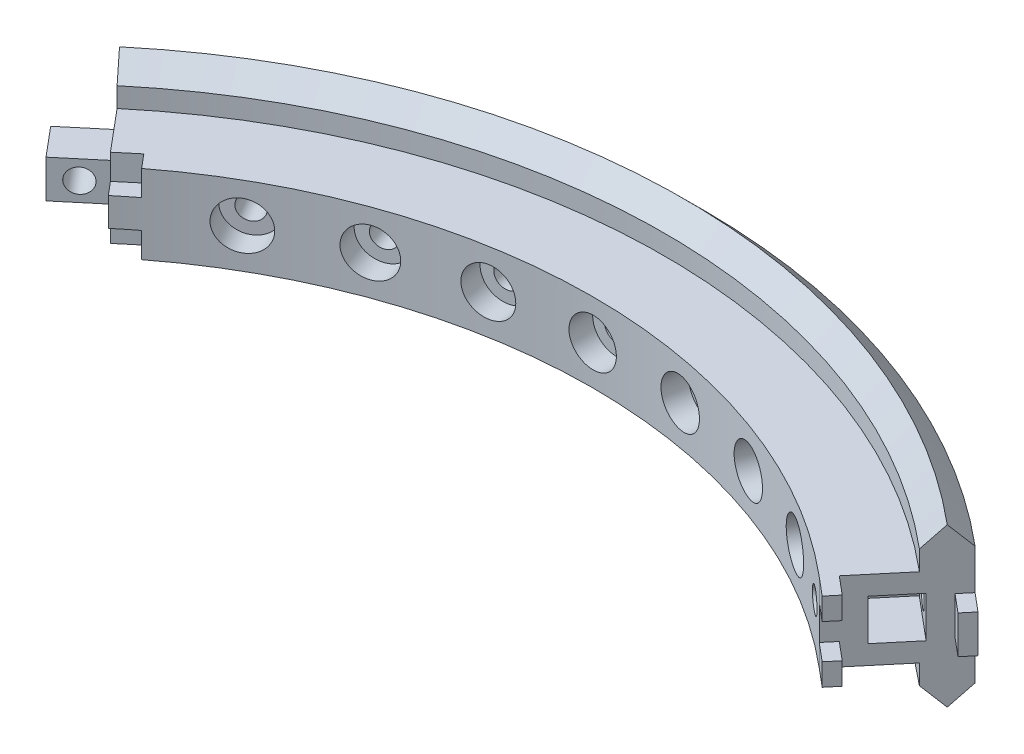
from build123d import *

# Parameters (mm, degrees)
REVOLVE_1_ANGLE          = 80
SKETCH_3_W               = 5.2
SKETCH_3_H               = 5.2
CUT_EXTRUDE_1_DEPTH      = 7
SKETCH_4_W               = 4.8
SKETCH_4_H               = 4.8
EXTRUDE_1_DEPTH          = 6
CUT_EXTRUDE_2_DEPTH      = 108.390367104
CUT_EXTRUDE_2_DEPTH_BACK = 108.390367104
SKETCH_5_R               = 1.5
CUT_EXTRUDE_START        = -1
SKETCH_6_R               = 3
CUT_EXTRUDE_3_DEPTH      = 109.709546841
SKETCH_7_R               = 1.5
CUT_EXTRUDE_4_DEPTH      = 109.021966902
SKETCH_11_R              = 1.5
CUT_EXTRUDE_6_DEPTH      = 65.328766587
CUT_EXTRUDE_7_DEPTH      = 5
SKETCH_13_W              = 3
SKETCH_13_H              = 3
PATTERN_CIRCULAR_1_COUNT = 4
PATTERN_CIRCULAR_1_ANGLE = 30
F_1_THE_OTHER_WAY_COUNT  = 4
F_1_THE_OTHER_WAY_ANGLE  = 30
SKETCH_9_W               = 1.8
SKETCH_9_H               = 4.8
SKETCH_9_H_2             = 2.8
EXTRUDE_2_DEPTH          = 3
SKETCH_10_W              = 2.2
SKETCH_10_H              = 5.2
CUT_EXTRUDE_5_DEPTH      = 3


# Read off the part's stored shape, not the designer's step: 旋转1
with BuildPart() as part:
    # 旋转1 outline → 旋转1 (revolve)
    with BuildSketch(Plane(origin=(0, 0, 0), x_dir=(0.6427876096865408, 0, -0.7660444431189768), z_dir=(0.7660444431189768, 0, 0.6427876096865408))):
        Polygon((79, 5), (70, 5), (70, -5), (79, -5), (79, -7.5), (81.5, -10), (84, -7.5), (84, 7.5), (81.5, 10), (79, 7.5), align=None)
    revolve(axis=Axis((0, 0, 0), (0, 1, 0)), revolution_arc=REVOLVE_1_ANGLE)

    # 草图3 → 切除-拉伸1 (cut)
    with BuildSketch(Plane(origin=(0, 0, 0), x_dir=(0.6427876096865405, 0, -0.766044443118977), z_dir=(0.7660444431189771, 0, 0.6427876096865406))):
        with Locations((77, 0)):
            Rectangle(SKETCH_3_W, SKETCH_3_H)
    extrude(amount=-CUT_EXTRUDE_1_DEPTH, mode=Mode.SUBTRACT)

    # 草图4 → 凸台-拉伸1 (add)
    with BuildSketch(Plane(origin=(0, 0, 0), x_dir=(0.6427876096865351, 0, 0.7660444431189817), z_dir=(-0.7660444431189817, 0, 0.6427876096865351))):
        with Locations((-77, 0)):
            Rectangle(SKETCH_4_W, SKETCH_4_H)
    extrude(amount=EXTRUDE_1_DEPTH)

    # 草图5 → 切除-拉伸2 (cut, two sides: drawn at the far end of the back side and taken through both)
    with BuildSketch(Plane(origin=(47.823398161, 0, -56.993706568), x_dir=(-0.7660444431189772, 0, -0.6427876096865404), z_dir=(0.6427876096865404, 0, -0.7660444431189772)).offset(-CUT_EXTRUDE_2_DEPTH_BACK)):
        with Locations((3.5, 0)):
            Circle(SKETCH_5_R)
    extrude(amount=CUT_EXTRUDE_2_DEPTH + CUT_EXTRUDE_2_DEPTH_BACK, mode=Mode.SUBTRACT)

    # 草图6 → 切除-拉伸3 (cut, through all)
    with BuildSketch(Plane(origin=(51.165893731, 0, -60.977137672), x_dir=(0.7660444431189772, 0, 0.6427876096865404), z_dir=(-0.6427876096865404, 0, 0.7660444431189772)).offset(CUT_EXTRUDE_START)):
        with Locations((-3.5, 0)):
            Circle(SKETCH_6_R)
    extrude(amount=-CUT_EXTRUDE_3_DEPTH, mode=Mode.SUBTRACT)

    # 草图7 → 切除-拉伸4 (cut, through all)
    with BuildSketch(Plane(origin=(-51.037336209, 0, -60.823928784), x_dir=(-0.7660444431189816, 0, 0.6427876096865353), z_dir=(-0.6427876096865353, 0, -0.7660444431189816))):
        with Locations((3, 0)):
            Circle(SKETCH_7_R)
    extrude(amount=-CUT_EXTRUDE_4_DEPTH, mode=Mode.SUBTRACT)

    # 草图11 → 切除-拉伸6 (cut, through all)
    with BuildSketch(Plane(origin=(0, 0, -84), x_dir=(-1, 0, 0), z_dir=(0, 0, -1))):
        Circle(SKETCH_11_R)
    cut_extrude_6 = extrude(amount=-CUT_EXTRUDE_6_DEPTH, mode=Mode.SUBTRACT)

    # 草图12 → 切除-拉伸7 (cut)
    with BuildSketch(Plane(origin=(0, 0, -84), x_dir=(-1, 0, 0), z_dir=(0, 0, -1))):
        Polygon((0, -3.175426481), (2.75, -1.58771324), (2.75, 1.58771324), (0, 3.175426481), (-2.75, 1.58771324), (-2.75, -1.58771324), align=None)
    cut_extrude_7 = extrude(amount=-CUT_EXTRUDE_7_DEPTH, mode=Mode.SUBTRACT)

    # 草图13 → 切除-旋转1 (revolve, cut)
    with BuildSketch(Plane(origin=(0, 0, 0), x_dir=(1, 0, 0), z_dir=(0, 1, 0)), mode=Mode.PRIVATE) as cut_revolve_1_sk:
        with Locations((1.5, 71.43568474)):
            Rectangle(SKETCH_13_W, SKETCH_13_H)
    cut_revolve_1 = revolve(cut_revolve_1_sk.sketch.rotate(Axis((0, 0, 1000), (0, 0, -1)), 180), axis=Axis((0, 0, 1000), (0, 0, -1)), mode=Mode.SUBTRACT)

    # 阵列(圆周)1: 切除-拉伸6, 切除-拉伸7, 切除-旋转1 ×4 about axis
    pattern_circular_1_axis = Axis((0, 0, 0), (0, -1, 0))
    add([cut_extrude_6.rotate(pattern_circular_1_axis, i * PATTERN_CIRCULAR_1_ANGLE / (PATTERN_CIRCULAR_1_COUNT - 1)) for i in range(1, PATTERN_CIRCULAR_1_COUNT)], mode=Mode.SUBTRACT)
    add([cut_extrude_7.rotate(pattern_circular_1_axis, i * PATTERN_CIRCULAR_1_ANGLE / (PATTERN_CIRCULAR_1_COUNT - 1)) for i in range(1, PATTERN_CIRCULAR_1_COUNT)], mode=Mode.SUBTRACT)
    add([cut_revolve_1.rotate(pattern_circular_1_axis, i * PATTERN_CIRCULAR_1_ANGLE / (PATTERN_CIRCULAR_1_COUNT - 1)) for i in range(1, PATTERN_CIRCULAR_1_COUNT)], mode=Mode.SUBTRACT)

    # 1 the other way: 切除-拉伸6, 切除-拉伸7, 切除-旋转1 ×4 about axis
    f_1_the_other_way_axis = Axis((0, 0, 0), (0, 1, 0))
    add([cut_extrude_6.rotate(f_1_the_other_way_axis, i * F_1_THE_OTHER_WAY_ANGLE / (F_1_THE_OTHER_WAY_COUNT - 1)) for i in range(1, F_1_THE_OTHER_WAY_COUNT)], mode=Mode.SUBTRACT)
    add([cut_extrude_7.rotate(f_1_the_other_way_axis, i * F_1_THE_OTHER_WAY_ANGLE / (F_1_THE_OTHER_WAY_COUNT - 1)) for i in range(1, F_1_THE_OTHER_WAY_COUNT)], mode=Mode.SUBTRACT)
    add([cut_revolve_1.rotate(f_1_the_other_way_axis, i * F_1_THE_OTHER_WAY_ANGLE / (F_1_THE_OTHER_WAY_COUNT - 1)) for i in range(1, F_1_THE_OTHER_WAY_COUNT)], mode=Mode.SUBTRACT)

    # 草图9 → 凸台-拉伸2 (add)
    with BuildSketch(Plane(origin=(0, 0, 0), x_dir=(0.6427876096865405, 0, -0.7660444431189771), z_dir=(0.7660444431189771, 0, 0.6427876096865405))):
        with Locations((83.1, 0)):
            Rectangle(SKETCH_9_W, SKETCH_9_H)
        with Locations((70.9, 3.6)):
            Rectangle(SKETCH_9_W, SKETCH_9_H_2)
        with Locations((70.9, -3.6)):
            Rectangle(SKETCH_9_W, SKETCH_9_H_2)
    extrude(amount=EXTRUDE_2_DEPTH)

    # 草图10 → 切除-拉伸5 (cut)
    with BuildSketch(Plane(origin=(0, 0, 0), x_dir=(0.6427876096865351, 0, 0.7660444431189817), z_dir=(-0.7660444431189817, 0, 0.6427876096865351))):
        with Locations((-82.9, 0)):
            Rectangle(SKETCH_10_W, SKETCH_10_H)
        Polygon((-72.2, 5), (-70, 5), (-68, 5), (-68, 1.8), (-70, 1.8), (-72.2, 1.8), align=None)
        Polygon((-72.2, -1.8), (-70, -1.8), (-68, -1.8), (-68, -5), (-70, -5), (-72.2, -5), align=None)
    extrude(amount=-CUT_EXTRUDE_5_DEPTH, mode=Mode.SUBTRACT)


solid = part.part
